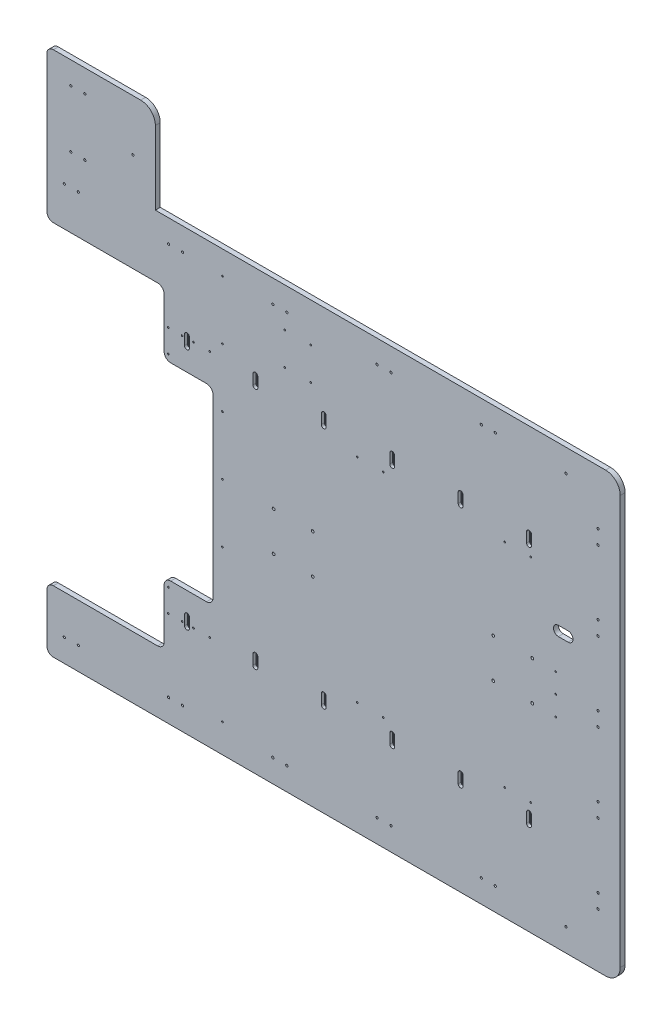
from build123d import *

# Parameters (mm, degrees)
SKETCH_1_W             = 1400
SKETCH_1_H             = 1345
EXTRUDE_1_DEPTH        = 7.5
SKETCH_2_W             = 400
SKETCH_2_H             = 240
EXTRUDE_2_DEPTH        = 15
SKETCH_3_W             = 400
SKETCH_3_H             = 270
EXTRUDE_3_DEPTH        = 15
SKETCH_4_W             = 100
SKETCH_4_H             = 270
CUT_EXTRUDE_1_DEPTH    = 25
SKETCH_5_W             = 40
SKETCH_5_H             = 1615
CUT_EXTRUDE_3_DEPTH    = 20
SKETCH_7_W             = 360
SKETCH_7_H             = 50
CUT_EXTRUDE_4_DEPTH    = 20
SKETCH_8_W             = 150
SKETCH_8_H             = 580
CUT_EXTRUDE_5_DEPTH    = 20
FILLET_1_R             = 20
FILLET_2_R             = 20
CUT_EXTRUDE_6_DEPTH    = 20
CUT_EXTRUDE_7_DEPTH    = 9
PATTERN_LINEAR_1_COUNT = 6
PATTERN_LINEAR_1_PITCH = 210
SKETCH_13_W            = 73
SKETCH_13_H            = 270
EXTRUDE_4_DEPTH        = 15
FILLET_3_R             = 45
CUT_EXTRUDE_8_DEPTH    = 1200
FILLET_4_R             = 45
HOLE_WIZARD_M6_1_D     = 5
HOLE_WIZARD_M6_2_D     = 5
HOLE_WIZARD_M6_3_D     = 5
HOLE_WIZARD_M6_4_D     = 5
HOLE_WIZARD_M6_5_D     = 5
PATTERN_LINEAR_2_COUNT = 5
PATTERN_LINEAR_2_PITCH = 180
FILLET_5_R             = 20
HOLE_WIZARD_M8_1_D     = 6.8
PATTERN_LINEAR_3_COUNT = 5
PATTERN_LINEAR_3_PITCH = 242
HOLE_WIZARD_M8_2_D     = 6.8
PATTERN_LINEAR_4_COUNT = 5
PATTERN_LINEAR_4_PITCH = 320
HOLE_WIZARD_M8_3_D     = 6.8
HOLE_WIZARD_M8_4_D     = 6.8
HOLE_WIZARD_M8_5_D     = 6.8
HOLE_WIZARD_M6_6_D     = 5
HOLE_WIZARD_M10_1_D    = 8.5
HOLE_WIZARD_M6_7_D     = 5


with BuildPart() as part:
    # 草图1 → 凸台-拉伸1 (new, symmetric)
    with BuildSketch(Plane.XY):
        Rectangle(SKETCH_1_W, SKETCH_1_H)
    extrude(amount=EXTRUDE_1_DEPTH, both=True)

    # 草图2 → 凸台-拉伸2 (add)
    with BuildSketch(Plane.XY.offset(7.5)):
        with Locations((-900, 552.5)):
            Rectangle(SKETCH_2_W, SKETCH_2_H)
        with Locations((-900, -552.5)):
            Rectangle(SKETCH_2_W, SKETCH_2_H)
    extrude(amount=-EXTRUDE_2_DEPTH)

    # 草图3 → 凸台-拉伸3 (add)
    with BuildSketch(Plane.XY.offset(7.5)):
        with Locations((-900, 807.5)):
            Rectangle(SKETCH_3_W, SKETCH_3_H)
    extrude(amount=-EXTRUDE_3_DEPTH)

    # 草图4 → 切除-拉伸1 (cut)
    with BuildSketch(Plane.XY.offset(7.5)):
        with Locations((-750, 807.5)):
            Rectangle(SKETCH_4_W, SKETCH_4_H)
    extrude(amount=-CUT_EXTRUDE_1_DEPTH, mode=Mode.SUBTRACT)

    # 草图5 → 切除-拉伸3 (cut)
    with BuildSketch(Plane.XY.offset(7.5)):
        with Locations((-1080, 135)):
            Rectangle(SKETCH_5_W, SKETCH_5_H)
    extrude(amount=-CUT_EXTRUDE_3_DEPTH, mode=Mode.SUBTRACT)

    # 草图7 → 切除-拉伸4 (cut)
    with BuildSketch(Plane.XY.offset(7.5)):
        with Locations((-880, 457.5)):
            Rectangle(SKETCH_7_W, SKETCH_7_H)
        with Locations((-880, -457.5)):
            Rectangle(SKETCH_7_W, SKETCH_7_H)
    extrude(amount=-CUT_EXTRUDE_4_DEPTH, mode=Mode.SUBTRACT)

    # 草图8 → 切除-拉伸5 (cut)
    with BuildSketch(Plane.XY.offset(7.5)):
        with Locations((-625, 0)):
            Rectangle(SKETCH_8_W, SKETCH_8_H)
    extrude(amount=-CUT_EXTRUDE_5_DEPTH, mode=Mode.SUBTRACT)

    # 圆角1
    fillet_1_edges = [part.edges().sort_by_distance(p)[0] for p in [
        (-550, 290, 0),
        (-550, -290, 0),
        (-700, -482.5, 0),
        (-700, 482.5, 0),
        (-700, 290, 0),
        (-700, -290, 0),
    ]]
    fillet(fillet_1_edges, radius=FILLET_1_R)

    # 圆角2
    fillet_2_edges = [part.edges().sort_by_distance(p)[0] for p in [
        (-1060, 482.5, 0),
        (-1060, -482.5, 0),
    ]]
    fillet(fillet_2_edges, radius=FILLET_2_R)

    # 草图9 → 切除-拉伸6 (cut)
    with BuildSketch(Plane.XY.offset(7.5)):
        with BuildLine():
            Line((415.5, -387.5), (415.5, -357.5))
            ThreePointArc((415.5, -357.5), (420, -353), (424.5, -357.5))
            Line((424.5, -357.5), (424.5, -387.5))
            ThreePointArc((424.5, -387.5), (420, -392), (415.5, -387.5))
        make_face()
        with BuildLine():
            Line((415.5, 357.5), (415.5, 387.5))
            ThreePointArc((415.5, 387.5), (420, 392), (424.5, 387.5))
            Line((424.5, 387.5), (424.5, 357.5))
            ThreePointArc((424.5, 357.5), (420, 353), (415.5, 357.5))
        make_face()
    cut_extrude_6 = extrude(amount=-CUT_EXTRUDE_6_DEPTH, mode=Mode.SUBTRACT)

    # 草图10 → 切除-拉伸7 (cut)
    with BuildSketch(Plane.XY.offset(7.5)):
        with BuildLine():
            Line((427.5, 387.5), (427.5, 357.5))
            ThreePointArc((427.5, 357.5), (420, 350), (412.5, 357.5))
            Line((412.5, 357.5), (412.5, 387.5))
            ThreePointArc((412.5, 387.5), (420, 395), (427.5, 387.5))
        make_face()
        with BuildLine():
            Line((427.5, -357.5), (427.5, -387.5))
            ThreePointArc((427.5, -387.5), (420, -395), (412.5, -387.5))
            Line((412.5, -387.5), (412.5, -357.5))
            ThreePointArc((412.5, -357.5), (420, -350), (427.5, -357.5))
        make_face()
    cut_extrude_7 = extrude(amount=-CUT_EXTRUDE_7_DEPTH, mode=Mode.SUBTRACT)

    # 阵列(线性)1: 切除-拉伸6, 切除-拉伸7 ×6
    with Locations(*[(-i * PATTERN_LINEAR_1_PITCH, 0, 0) for i in range(1, PATTERN_LINEAR_1_COUNT)]):
        add(cut_extrude_6, mode=Mode.SUBTRACT)
        add(cut_extrude_7, mode=Mode.SUBTRACT)

    # 草图13 → 凸台-拉伸4 (add)
    with BuildSketch(Plane.XY.offset(7.5)):
        with Locations((-763.5, 807.5)):
            Rectangle(SKETCH_13_W, SKETCH_13_H)
    extrude(amount=-EXTRUDE_4_DEPTH)

    # 圆角3
    fillet_3_edges = [part.edges().sort_by_distance(p)[0] for p in [
        (700, 672.5, 0),
        (700, -672.5, 0),
    ]]
    fillet(fillet_3_edges, radius=FILLET_3_R)

    # 草图14 → 切除-拉伸8 (cut)
    with BuildSketch(Plane.XY.offset(7.5)):
        with BuildLine():
            Line((510, 187.5), (540, 187.5))
            ThreePointArc((540, 187.5), (555, 172.5), (540, 157.5))
            Line((540, 157.5), (510, 157.5))
            ThreePointArc((510, 157.5), (495, 172.5), (510, 187.5))
        make_face()
    extrude(amount=-CUT_EXTRUDE_8_DEPTH, mode=Mode.SUBTRACT)

    # 圆角4
    fillet_4_edges = [part.edges().sort_by_distance(p)[0] for p in [
        (-727, 942.5, 0),
    ]]
    fillet(fillet_4_edges, radius=FILLET_4_R)

    # M6 螺纹孔1 (through all)
    with Locations(Plane.XY.offset(7.5)):
        with Locations((425, -326.499993968), (345, -326.499993968), (425, 326.500006032), (345, 326.500006032), (-107, -326.499993968), (-27, -326.499993968), (-107, 326.500006032), (-27, 326.500006032)):
            Hole(HOLE_WIZARD_M6_1_D / 2)

    # M6 螺纹孔2 (through all)
    with Locations(Plane.XY.offset(7.5)):
        with Locations((-330, 552.5), (-250, 552.5), (-250, 452.5), (-330, 452.5)):
            Hole(HOLE_WIZARD_M6_2_D / 2)

    # M6 螺纹孔3 (through all)
    with Locations(Plane.XY.offset(7.5)):
        with Locations((-560, 380), (-610, 380), (-645, 380), (-687, 380), (-687, -380), (-645, -380), (-610, -380), (-560, -380)):
            Hole(HOLE_WIZARD_M6_3_D / 2)

    # M6 螺纹孔4 (through all)
    with Locations(Plane.XY.offset(7.5)):
        with Locations((-521, -584.999993968)):
            Hole(HOLE_WIZARD_M6_4_D / 2)

    # M6 螺纹孔5 (through all)
    with Locations(Plane.XY.offset(7.5)):
        with Locations((-521.000000698, 600)):
            hole_wizard_m6_5 = Hole(HOLE_WIZARD_M6_5_D / 2)

    # 阵列(线性)2: M6 螺纹孔5 ×5
    with Locations(*[(0, -i * PATTERN_LINEAR_2_PITCH, 0) for i in range(1, PATTERN_LINEAR_2_COUNT)]):
        add(hole_wizard_m6_5, mode=Mode.SUBTRACT)

    # 圆角5
    fillet_5_edges = [part.edges().sort_by_distance(p)[0] for p in [
        (-1060, -672.5, 0),
        (-1060, 942.5, 0),
    ]]
    fillet(fillet_5_edges, radius=FILLET_5_R)

    # M8 螺纹孔1 (through all)
    with Locations(Plane.XY.offset(7.5)):
        with Locations((632, -506), (632, -462.999991656)):
            hole_wizard_m8_1 = Hole(HOLE_WIZARD_M8_1_D / 2)

    # 阵列(线性)3: M8 螺纹孔1 ×5
    with Locations(*[(0, i * PATTERN_LINEAR_3_PITCH, 0) for i in range(1, PATTERN_LINEAR_3_COUNT)]):
        add(hole_wizard_m8_1, mode=Mode.SUBTRACT)

    # M8 螺纹孔2 (through all)
    with Locations(Plane.XY.offset(7.5)):
        with Locations((-1006.5, 602.5), (-963.5, 602.5), (-1006.5, -602.5), (-963.5, -602.5)):
            hole_wizard_m8_2 = Hole(HOLE_WIZARD_M8_2_D / 2)

    # 阵列(线性)4: M8 螺纹孔2 ×5
    with Locations(*[(i * PATTERN_LINEAR_4_PITCH, 0, 0) for i in range(1, PATTERN_LINEAR_4_COUNT)]):
        add(hole_wizard_m8_2, mode=Mode.SUBTRACT)

    # M8 螺纹孔3 (through all)
    with Locations(Plane.XY.offset(7.5)):
        with Locations((533.499999302, 602.5), (533.499999302, -602.5)):
            Hole(HOLE_WIZARD_M8_3_D / 2)

    # M8 螺纹孔4 (through all)
    with Locations(Plane.XY.offset(7.5)):
        with Locations((-986.5, 873.5), (-943.5, 873.5), (-986.5, 697.5), (-943.5, 697.5)):
            Hole(HOLE_WIZARD_M8_4_D / 2)

    # M8 螺纹孔5 (through all)
    with Locations(Plane.XY.offset(7.5)):
        with Locations((-796, 785)):
            Hole(HOLE_WIZARD_M8_5_D / 2)

    # M6 螺纹孔6 (through all)
    with Locations(Plane(origin=(0, 0, -7.5), x_dir=(-1, 0, 0), z_dir=(0, 0, -1))):
        with Locations((-502, 60), (-502, 0), (-502, -60)):
            Hole(HOLE_WIZARD_M6_6_D / 2)

    # M10 螺纹孔1 (through all)
    with Locations(Plane.XY.offset(7.5)):
        with Locations((-364, 60), (-244, 60), (-364, -60), (-244, -60), (310, 60), (430, 60), (310, -60), (430, -60)):
            Hole(HOLE_WIZARD_M10_1_D / 2)

    # M6 螺纹孔7 (through all)
    with Locations(Plane.XY.offset(7.5)):
        with Locations((-687, 310), (-687, -310)):
            Hole(HOLE_WIZARD_M6_7_D / 2)


solid = part.part
